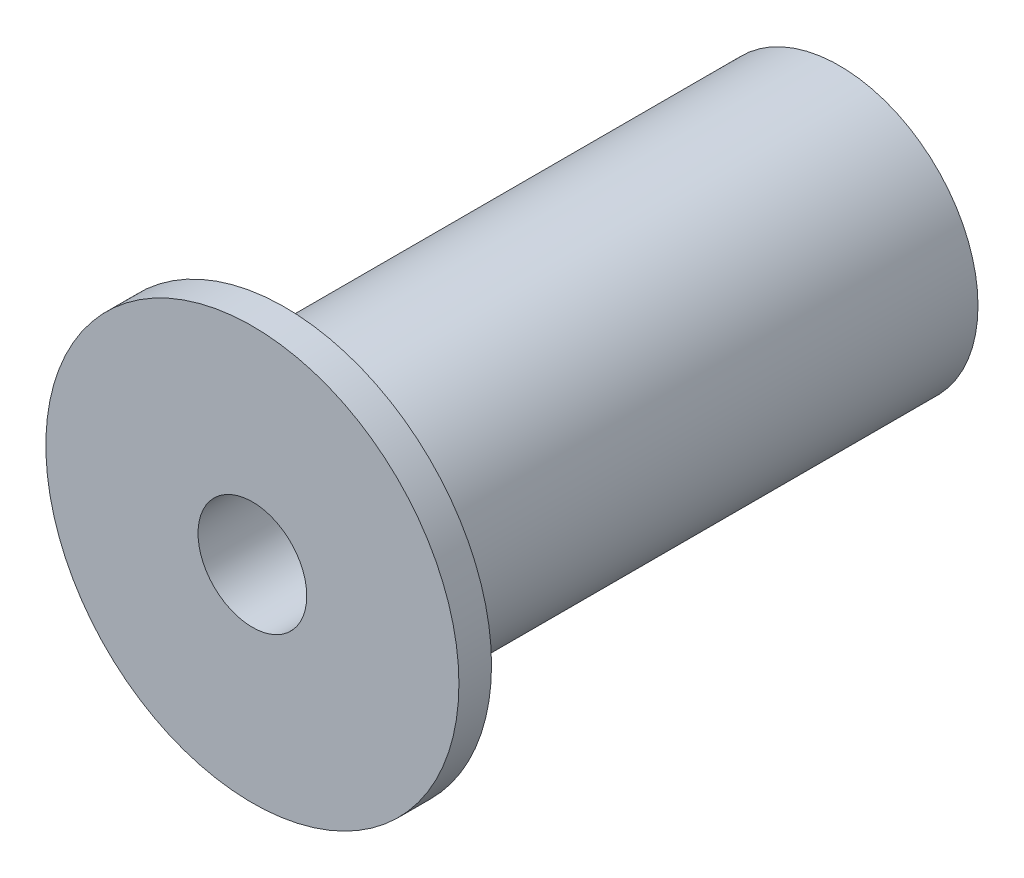
from build123d import *

# Parameters (mm, degrees)
SKETCH1_R          = 19
EXTRUDE1_DEPTH     = 3
SKETCH2_R          = 12.75
EXTRUDE2_DEPTH     = 51
EXTRUDE3_START     = -26
EXTRUDE3_OUTLINE_R = 5
EXTRUDE3_DEPTH     = 26
EXTRUDE5_START     = -28
EXTRUDE5_OUTLINE_R = 3
EXTRUDE5_DEPTH     = 28
CHAMFER1_SIZE      = 1.57
SCALE1_SCALE       = 0.5


# Read off the part's stored shape, not the designer's step: Extrude3, Extrude5
with BuildPart() as part:
    # Sketch1 → Extrude1 (new body)
    with BuildSketch(Plane.XY):
        Circle(SKETCH1_R)
    extrude(amount=EXTRUDE1_DEPTH)

    # Sketch2 → Extrude2 (add)
    with BuildSketch(Plane(origin=(0, 0, 0), x_dir=(-1, 0, 0), z_dir=(0, 0, -1))):
        with Locations(Location((0, 0, 0), (0, 0, 180))):
            Circle(SKETCH2_R)
    extrude(amount=EXTRUDE2_DEPTH)

    # Extrude3 outline → Extrude3 (cut)
    with BuildSketch(Plane.XY.offset(3).offset(EXTRUDE3_START)):
        Circle(EXTRUDE3_OUTLINE_R)
    extrude(amount=EXTRUDE3_DEPTH, mode=Mode.SUBTRACT)

    # Extrude5 outline → Extrude5 (cut)
    with BuildSketch(Plane(origin=(0, 0, -51), x_dir=(-1, 0, 0), z_dir=(0, 0, -1)).offset(EXTRUDE5_START)):
        Circle(EXTRUDE5_OUTLINE_R)
    extrude(amount=EXTRUDE5_DEPTH, mode=Mode.SUBTRACT)

    # Chamfer1
    chamfer1_edges = [part.edges().sort_by_distance(p)[0] for p in [
        (3, 0, -23),
    ]]
    chamfer(chamfer1_edges, length=CHAMFER1_SIZE)


with BuildPart() as part_1:
    # Scale1: scaled about (0, 0, 0)
    add(part.part.scale(SCALE1_SCALE))


solid = part_1.part
